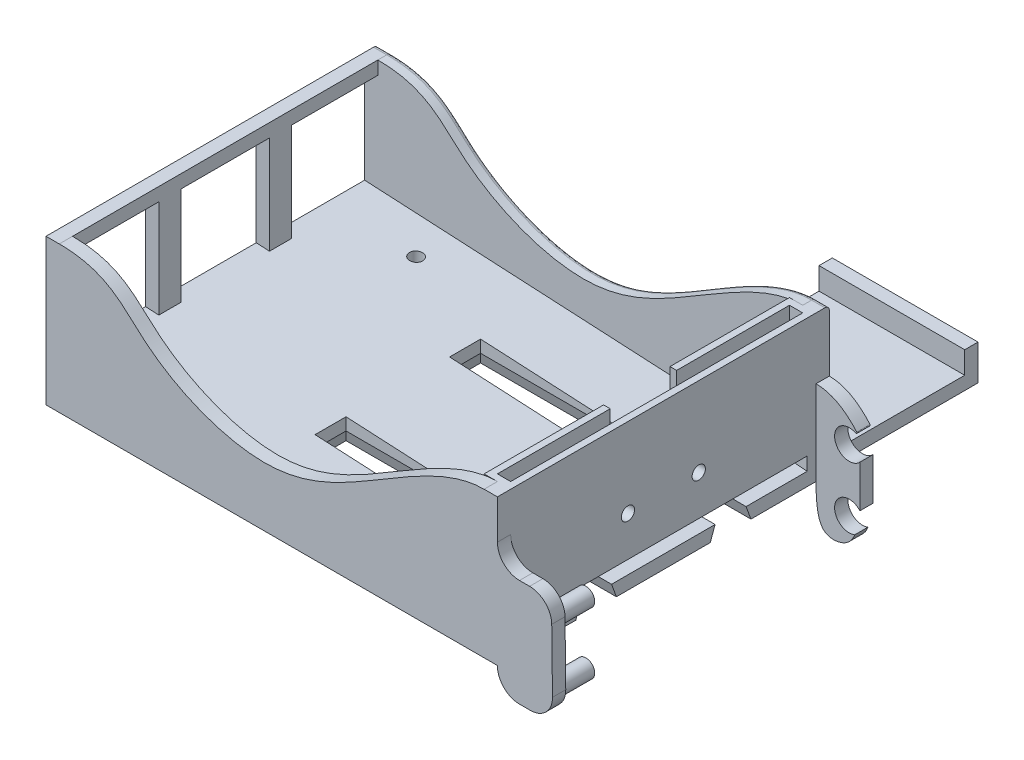
from build123d import *

# Parameters (mm, degrees)
EXTRUDE_1_DEPTH                 = 30
SKETCH_2_W                      = 102
SKETCH_2_H                      = 75
EXTRUDE_1_2_DEPTH               = 3
CUT_EXTRUDE_1_REACH             = 114.74
SKETCH_3_W                      = 66
SKETCH_3_H                      = 3
SKETCH_6_W                      = 19.5
SKETCH_6_H                      = 30
SKETCH_6_W_2                    = 20
CUT_EXTRUDE_3_DEPTH             = 3
CUT_EXTRUDE_4_REACH             = 98.068
CUT_EXTRUDE_4_DIRECTION_2_DEPTH = 97.067684473
EXTRUDE_4_DEPTH                 = 3
FILLET_2_R                      = 1
SKETCH_8_R                      = 1.5
CUT_EXTRUDE_5_DEPTH             = 6
CHAMFER_2_SIZE                  = 2
EXTRUDE_3_REACH                 = 95.744
SKETCH_4_W                      = 60
SKETCH_4_H                      = 7
CUT_EXTRUDE_2_DEPTH             = 71.783119625
CUT_EXTRUDE_2_TAPER             = -20
CUT_EXTRUDE_2_OTHER_WAY_DEPTH   = 3
SKETCH_15_R                     = 1.5
CUT_EXTRUDE_6_DEPTH             = 73.105825177
PATTERN_START                   = -3
PATTERN_LINEAR_1_OUTLINE_R      = 1.5
PATTERN_LINEAR_1_DEPTH          = 7.022138069
CUT_EXTRUDE_7_DEPTH             = 73.105825177
CUT_EXTRUDE_7_DEPTH_BACK        = 10
SKETCH_17_W                     = 1.5
SKETCH_17_H                     = 7.5
EXTRUDE_START                   = -3
SKETCH_18_W                     = 72.194162213
SKETCH_18_H                     = 3
EXTRUDE_5_DEPTH                 = 3
SKETCH_19_R                     = 2
EXTRUDE_6_DEPTH                 = 12.5
EXTRUDE_6_2_DEPTH               = 12.5
EXTRUDE_7_DEPTH                 = 3
EXTRUDE_8_DEPTH                 = 3
FILLET_6_R                      = 5
SKETCH_23_W                     = 32.926389999
SKETCH_23_H                     = 3
EXTRUDE_9_DEPTH                 = 33.6
SKETCH_24_W                     = 32.926389999
SKETCH_24_H                     = 3
EXTRUDE_10_DEPTH                = 5
EXTRUDE_12_DEPTH                = 10


# Read off the part's stored shape, not the designer's step: 阵列(线性)1, 凸台-拉伸8
with BuildPart() as part:
    # 草图1 → Extrude 1 (new body)
    with BuildSketch(Plane(origin=(0, 0, 0), x_dir=(1, 0, 0), z_dir=(0, 1, 0))):
        Polygon((50, -37.5), (50, 37.5), (-47, 37.5), (-52, 37.5), (-52, -37.5), (-47, -37.5), align=None)
        Polygon((47, -34.5), (47, 34.5), (-47, 34.5), (-49, 34.5), (-49, -34.5), (-47, -34.5), align=None, mode=Mode.SUBTRACT)
    extrude(amount=EXTRUDE_1_DEPTH)

    # 草图2 → Extrude 1 2 (add)
    with BuildSketch(Plane.XZ):
        with Locations((-1, 0)):
            Rectangle(SKETCH_2_W, SKETCH_2_H)
    extrude(amount=EXTRUDE_1_2_DEPTH)

    # 草图3 → 切除-拉伸1 (cut, up to next)
    with BuildSketch(Plane(origin=(50, 0, 0), x_dir=(0, 0, -1), z_dir=(1, 0, 0)), mode=Mode.PRIVATE) as cut_extrude_1_sk1:
        with Locations((0, 1.5)):
            Rectangle(SKETCH_3_W, SKETCH_3_H)
    cut_extrude_1_tool1 = extrude(cut_extrude_1_sk1.sketch, amount=-CUT_EXTRUDE_1_REACH, mode=Mode.PRIVATE) & part.part
    add(cut_extrude_1_tool1.solids().sort_by_distance((50, 1.5, 0))[0], mode=Mode.SUBTRACT)

    # 草图6 → 切除-拉伸3 (cut)
    with BuildSketch(Plane.ZY.offset(52)):
        with Locations((-24.75, 15)):
            Rectangle(SKETCH_6_W, SKETCH_6_H)
        with Locations((0, 15)):
            Rectangle(SKETCH_6_W_2, SKETCH_6_H)
        with Locations((24.75, 15)):
            Rectangle(SKETCH_6_W, SKETCH_6_H)
    extrude(amount=-CUT_EXTRUDE_3_DEPTH, mode=Mode.SUBTRACT)

    # 切除-拉伸4: up to this face of the body (flat: up to its plane)
    cut_extrude_4_end = Plane(part.part.faces().sort_by_distance((-1, 13.5, 37.5))[0])
    # 草图7 → 切除-拉伸4 (cut, up to the picked face)
    with BuildSketch(Plane(origin=(0, 0, -37.5), x_dir=(-1, 0, 0), z_dir=(0, 0, -1)), mode=Mode.PRIVATE) as cut_extrude_4_sk1:
        with BuildLine():
            Line((-47, 30), (49, 30))
            add(Edge.make_bspline(
                [(-47, 30), (-37.805676874, 30), (-19.339792463, 16.145854693), (3.988000701, 7.312709077), (29.289879938, 17.151011111), (38.269056048, 30), (49, 30)],
                knots=[0, 0, 0, 0, 0.324171124, 0.528818049, 0.818204235, 1, 1, 1, 1], degree=3))
        make_face()
    cut_extrude_4_tool1 = split(extrude(cut_extrude_4_sk1.sketch, amount=-CUT_EXTRUDE_4_REACH, mode=Mode.PRIVATE), bisect_by=cut_extrude_4_end, keep=Keep.BOTH, mode=Mode.PRIVATE)
    add(cut_extrude_4_tool1.solids().sort_by(Axis((-1.873813, 22.412974, -37.5), (0, 0, 1)))[0], mode=Mode.SUBTRACT)

    # 草图7 → 切除-拉伸4 direction 2 (cut)
    with BuildSketch(Plane(origin=(0, 0, -37.5), x_dir=(-1, 0, 0), z_dir=(0, 0, -1))):
        with BuildLine():
            Line((-47, 30), (49, 30))
            add(Edge.make_bspline(
                [(-47, 30), (-37.805676874, 30), (-19.339792463, 16.145854693), (3.988000701, 7.312709077), (29.289879938, 17.151011111), (38.269056048, 30), (49, 30)],
                knots=[0, 0, 0, 0, 0.324171124, 0.528818049, 0.818204235, 1, 1, 1, 1], degree=3))
        make_face()
    extrude(amount=CUT_EXTRUDE_4_DIRECTION_2_DEPTH, mode=Mode.SUBTRACT)

    # 草图16 → 凸台-拉伸4 (add)
    with BuildSketch(Plane.ZY.offset(-47)):
        Polygon((-33, 3), (33, 3), (33, 0), (34.5, 0), (34.5, 30), (-34.5, 30), (-34.5, 0), (-33, 0), align=None)
    extrude(amount=EXTRUDE_4_DEPTH)

    # 圆角2
    fillet_2_edges = [part.edges().sort_by_distance(p)[0] for p in [
        (-50.5, 30, -37.5),
        (-1.441113717, 10.397953524, -37.5),
        (48.5, 30, -37.5),
    ]]
    fillet(fillet_2_edges, radius=FILLET_2_R)

    # 草图8 → 切除-拉伸5 (cut)
    with BuildSketch(Plane(origin=(50, 0, 0), x_dir=(0, 0, -1), z_dir=(1, 0, 0))):
        with Locations((-8, 12)):
            Circle(SKETCH_8_R)
        with Locations(Location((8, 12, 0), (0, 0, 180))):
            Circle(SKETCH_8_R)
    extrude(amount=-CUT_EXTRUDE_5_DEPTH, mode=Mode.SUBTRACT)

    # 倒角2
    chamfer_2_edges = [part.edges().sort_by_distance(p)[0] for p in [
        (44, 3, 0),
    ]]
    chamfer(chamfer_2_edges, length=CHAMFER_2_SIZE)

    # 草图14 → 凸台-拉伸3 (add, up to next)
    with BuildSketch(Plane.XY.offset(-34.5), mode=Mode.PRIVATE) as extrude_3_sk1:
        Polygon((-52, 0), (-52, 4.978739032), (43, 0), align=None)
    extrude_3_tool1 = extrude(extrude_3_sk1.sketch, amount=EXTRUDE_3_REACH, mode=Mode.PRIVATE) - part.part
    add(extrude_3_tool1.solids().sort_by_distance((-20.333333, 1.65958, -34.5))[0])

    # 草图4 → 切除-拉伸2 (cut)
    with BuildSketch(Plane(origin=(0, 0, 0), x_dir=(1, 0, 0), z_dir=(0, 1, 0))):
        with Locations((20, 15.2)):
            Rectangle(SKETCH_4_W, SKETCH_4_H)
        with Locations((20, -15.2)):
            Rectangle(SKETCH_4_W, SKETCH_4_H)
    extrude(amount=-CUT_EXTRUDE_2_DEPTH, taper=CUT_EXTRUDE_2_TAPER, mode=Mode.SUBTRACT)

    # 草图4 → 切除-拉伸2 other way (cut)
    with BuildSketch(Plane(origin=(0, 0, 0), x_dir=(1, 0, 0), z_dir=(0, 1, 0))):
        with Locations((20, 15.2)):
            Rectangle(SKETCH_4_W, SKETCH_4_H)
        with Locations((20, -15.2)):
            Rectangle(SKETCH_4_W, SKETCH_4_H)
    extrude(amount=CUT_EXTRUDE_2_OTHER_WAY_DEPTH, mode=Mode.SUBTRACT)

    # 草图15 → 切除-拉伸6 (cut, symmetric)
    with BuildSketch(Plane.XZ.offset(3)):
        with Locations(Location((-32.246964371, 26.621359436, 0), (0, 0, 270))):
            Circle(SKETCH_15_R)
    extrude(amount=CUT_EXTRUDE_6_DEPTH, both=True, mode=Mode.SUBTRACT)

    # 阵列(线性)1 outline → 阵列(线性)1 (cut)
    with BuildSketch(Plane(origin=(0, 0, 0), x_dir=(1, 0, 0), z_dir=(0, 1, 0)).offset(PATTERN_START)):
        with Locations((22.677660041, 26.378640564)):
            Circle(PATTERN_LINEAR_1_OUTLINE_R)
        with Locations((-32.246964371, 26.378640564)):
            Circle(PATTERN_LINEAR_1_OUTLINE_R)
        with Locations((22.677660041, -26.621359436)):
            Circle(PATTERN_LINEAR_1_OUTLINE_R)
    extrude(amount=PATTERN_LINEAR_1_DEPTH, mode=Mode.SUBTRACT)

    # 草图17 → 切除-拉伸7 (cut, two sides: drawn at the far end of the back side and taken through both)
    with BuildSketch(Plane(origin=(0, 30, 0), x_dir=(1, 0, 0), z_dir=(0, 1, 0)).offset(-CUT_EXTRUDE_7_DEPTH_BACK)):
        with Locations((44.75, 3.75)):
            Rectangle(SKETCH_17_W, SKETCH_17_H)
        Polygon((45.5, 7.5), (45.5, 0), (48.5, 0), (48.5, 33), (45.5, 33), align=None)
        with Locations((44.75, -3.75)):
            Rectangle(SKETCH_17_W, SKETCH_17_H)
        Polygon((48.5, 0), (45.5, 0), (45.5, -7.5), (45.5, -33), (48.5, -33), align=None)
    extrude(amount=CUT_EXTRUDE_7_DEPTH + CUT_EXTRUDE_7_DEPTH_BACK, mode=Mode.SUBTRACT)

    # 草图18 → 凸台-拉伸5 (add)
    with BuildSketch(Plane.ZY.offset(52).offset(EXTRUDE_START)):
        with Locations((0.097081107, 28.5)):
            Rectangle(SKETCH_18_W, SKETCH_18_H)
    extrude(amount=EXTRUDE_5_DEPTH)



with BuildPart() as body_2:
    # 草图19 → 凸台-拉伸6 (new body)
    with BuildSketch(Plane.XY.offset(37.5)):
        with Locations((57.5, -6)):
            Circle(SKETCH_19_R)
    extrude(amount=-EXTRUDE_6_DEPTH)


with BuildPart() as body_3:
    # 草图19 → Extrude 6 2 (new body)
    with BuildSketch(Plane.XY.offset(37.5)):
        with Locations((57.5, 8)):
            Circle(SKETCH_19_R)
    extrude(amount=-EXTRUDE_6_2_DEPTH)


with BuildPart() as part_1:
    add(part.part)

    add(body_2.part)  # 凸台-拉伸7 merges body 2

    add(body_3.part)  # 凸台-拉伸7 merges body 3
    # 草图21 → 凸台-拉伸7 (add)
    with BuildSketch(Plane.XY.offset(37.5)):
        Polygon((50, 16.13825765), (62.22131939, 16.13825765), (62.511022991, -8.062407424), (50, -8.062407424), (50, -3), align=None)
    extrude(amount=-EXTRUDE_7_DEPTH)

    # 凸台-拉伸8 outline → 凸台-拉伸8 (add)
    with BuildSketch(Plane(origin=(0, 0, -37.5), x_dir=(-1, 0, 0), z_dir=(0, 0, -1)).offset(EXTRUDE_START)):
        with BuildLine():
            Line((-50, -3.039727421), (-50, 16.13825765))
            add(Edge.make_bspline(
                [(-50, 16.13825765), (-55.030993211, 16.103706383), (-59.204714415, 11.267105496)],
                knots=[0, 0, 0, 1, 1, 1], degree=2))
            ThreePointArc((-59.204714415, 11.267105496), (-59.211378076, 11.013923295), (-58.964538163, 10.957216253))
            ThreePointArc((-58.964538163, 10.957216253), (-54.255126377, 7.399337721), (-59.926050118, 5.762975005))
            Line((-59.926050118, 5.762975005), (-59.926050118, -3.762975005))
            ThreePointArc((-59.926050118, -3.762975005), (-54.279356741, -5.280655159), (-58.743678908, -9.056675118))
            add(Edge.make_bspline(
                [(-58.743678908, -9.056675118), (-57.378990163, -12.762657615), (-54.18208258, -12.762657615), (-51.639527628, -12.762657615), (-50.050430784, -12.762657615), (-50, -3.039727421)],
                knots=[0, 0, 0, 0, 0, 0, 1, 1, 1, 1, 1, 1], degree=5))
        make_face()
    extrude(amount=EXTRUDE_8_DEPTH)

    # 圆角6
    fillet_6_edges = [part_1.edges().sort_by_distance(p)[0] for p in [
        (50, 16.13825765, 36),
        (62.22131939, 16.13825765, 36),
        (62.511022991, -8.062407424, 36),
        (50, -8.062407424, 36),
    ]]
    fillet(fillet_6_edges, radius=FILLET_6_R)

    # 草图23 → 凸台-拉伸9 (add)
    with BuildSketch(Plane(origin=(0, 0, -37.5), x_dir=(-1, 0, 0), z_dir=(0, 0, -1))):
        with Locations((-33.540633652, -0.5)):
            Rectangle(SKETCH_23_W, SKETCH_23_H)
    extrude(amount=EXTRUDE_9_DEPTH)

    # 草图24 → 凸台-拉伸10 (add)
    with BuildSketch(Plane(origin=(0, 1, 0), x_dir=(1, 0, 0), z_dir=(0, 1, 0))):
        with Locations((33.540633652, 69.6)):
            Rectangle(SKETCH_24_W, SKETCH_24_H)
    extrude(amount=EXTRUDE_10_DEPTH)

    # 草图26 → 凸台-拉伸12 (add)
    with BuildSketch(Plane.XZ.offset(3)):
        Polygon((25, 34.5), (50, 32.5), (50, 34.5), align=None)
        Polygon((50, -32.5), (50, -34.5), (25, -34.5), align=None)
    extrude(amount=-EXTRUDE_12_DEPTH)


solid = part_1.part
